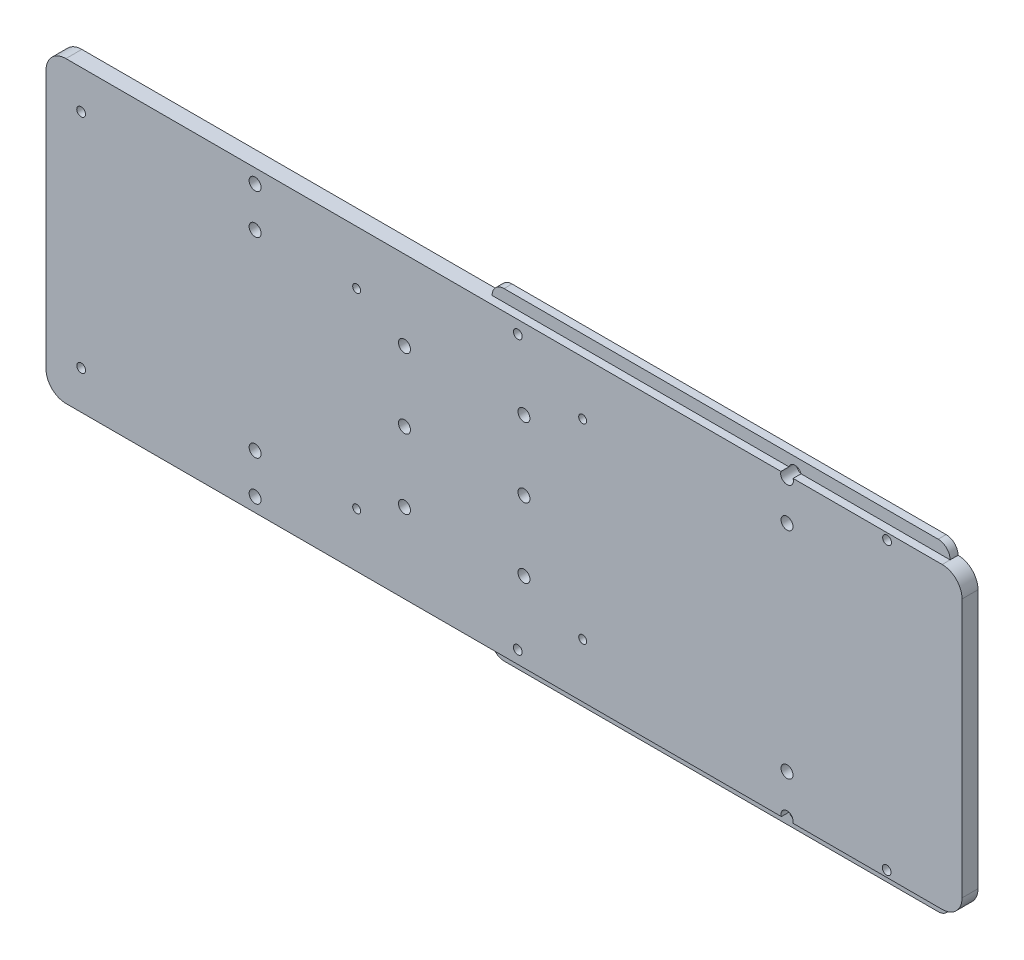
from build123d import *

# Parameters (mm, degrees)
SKETCH1_W             = 230
SKETCH1_H             = 75
BOSS_EXTRUDE1_DEPTH   = 4
CUT_EXTRUDE1_DEPTH    = 1
FILLET1_R             = 5
SKETCH4_W             = 115
SKETCH4_H             = 3
BOSS_EXTRUDE2_DEPTH   = 2
BOSS_EXTRUDE2_2_DEPTH = 2
FILLET4_R             = 3
FILLET5_R             = 3
FILLET6_R             = 3
SKETCH5_R             = 1.1
CUT_EXTRUDE2_DEPTH    = 243.899156125
SKETCH6_R             = 1.5
CUT_EXTRUDE3_DEPTH    = 243.899156125
SKETCH7_R             = 1.5
CUT_EXTRUDE4_DEPTH    = 243.899156125
SKETCH8_R             = 1
CUT_EXTRUDE5_DEPTH    = 243.899156125
SKETCH6_3_R           = 1.5
CUT_EXTRUDE6_DEPTH    = 10
SKETCH9_R             = 1.5
SKETCH9_R_2           = 1.6
CUT_EXTRUDE7_DEPTH    = 10


with BuildPart() as part:
    # Sketch1 → Boss-Extrude1 (new body)
    with BuildSketch(Plane.XY):
        with Locations((115, 37.5)):
            Rectangle(SKETCH1_W, SKETCH1_H)
    extrude(amount=BOSS_EXTRUDE1_DEPTH)

    # Sketch2 → Cut-Extrude1 (cut)
    # profile 1 of 6: a face of its own
    with BuildSketch(Plane(origin=(0, 0, 0), x_dir=(-1, 0, 0), z_dir=(0, 0, -1))):
        with BuildLine():
            Line((-12.568483623, 29.103311562), (-12.568483623, 29.786204191))
            add(Edge.make_bspline(
                [(-12.568483623, 29.786204191), (-12.56831064, 29.819633196), (-12.567975355, 29.884426928), (-12.562654622, 29.978639205), (-12.55558121, 30.066912835), (-12.543715943, 30.149091828), (-12.531413227, 30.225710909), (-12.513355784, 30.295992234), (-12.49341068, 30.360524497), (-12.462722431, 30.438014536), (-12.415063194, 30.525937603), (-12.344380016, 30.620438448), (-12.259636594, 30.702584349), (-12.16306478, 30.772432715), (-12.056824841, 30.828487514), (-11.943202564, 30.868527648), (-11.824109507, 30.894250956), (-11.742460206, 30.896863181), (-11.701195963, 30.898183357)],
                knots=[0, 0, 0, 0, 1.00128172, 1.940733171, 2.826250472, 3.653024905, 4.427672124, 5.149348099, 5.824709082, 6.450061444, 7.643590664, 8.808605388, 9.972104426, 11.165284501, 12.367876273, 13.557044126, 14.765369432, 16, 16, 16, 16], degree=3))
            add(Edge.make_bspline(
                [(-11.701195963, 30.898183357), (-11.662545107, 30.897083747), (-11.58659253, 30.894922908), (-11.475694689, 30.874511937), (-11.370237326, 30.84211681), (-11.270310695, 30.797345438), (-11.177774939, 30.73966003), (-11.09291671, 30.670544802), (-11.018943182, 30.587503409), (-10.977603369, 30.5252553), (-10.956604617, 30.493636082)],
                knots=[0, 0, 0, 0, 1.044641374, 2.052818814, 3.038628718, 4.023282556, 5.005660861, 5.98021751, 6.974042014, 8, 8, 8, 8], degree=3))
            add(Edge.make_bspline(
                [(-10.956604617, 30.493636082), (-10.941334675, 30.53339267), (-10.912119494, 30.609456872), (-10.860548157, 30.714192694), (-10.804253114, 30.804100181), (-10.743725887, 30.88093563), (-10.677521759, 30.946302707), (-10.605102849, 31.002914377), (-10.526528446, 31.051856268), (-10.442087333, 31.093505478), (-10.352495359, 31.126221453), (-10.258846799, 31.150267241), (-10.161500655, 31.164490847), (-10.095439613, 31.166431165), (-10.061973207, 31.167414127)],
                knots=[0, 0, 0, 0, 1.272586185, 2.434772614, 3.483318042, 4.437947805, 5.351807173, 6.25737843, 7.180033415, 8.1141739, 9.066731021, 10.025721652, 10.999834114, 12, 12, 12, 12], degree=3))
            add(Edge.make_bspline(
                [(-10.061973207, 31.167414127), (-10.027806196, 31.166437494), (-9.960581644, 31.164515942), (-9.861828495, 31.150332921), (-9.76744625, 31.126335022), (-9.676867921, 31.093222638), (-9.590283418, 31.050303477), (-9.508006409, 30.99731737), (-9.429865717, 30.935008136), (-9.355723433, 30.86458863), (-9.287880913, 30.786111599), (-9.229559225, 30.69962486), (-9.179410885, 30.607497729), (-9.138581895, 30.508552447), (-9.107082356, 30.403041601), (-9.085135841, 30.291023904), (-9.0703235, 30.172683832), (-9.069107322, 30.091473486), (-9.068483623, 30.049825986)],
                knots=[0, 0, 0, 0, 0.978680899, 1.925582087, 2.851223405, 3.764209995, 4.683484765, 5.614004905, 6.562443559, 7.542772147, 8.539900013, 9.527881485, 10.525548727, 11.540192123, 12.58875426, 13.674701727, 14.807505862, 16, 16, 16, 16], degree=3))
            Line((-9.068483623, 30.049825986), (-9.068483623, 29.103311562))
            Line((-9.068483623, 29.103311562), (-12.568483623, 29.103311562))
        make_face()
        with BuildLine():
            Line((-12.209509265, 29.417414127), (-11.087714393, 29.417414127))
            Line((-11.087714393, 29.417414127), (-11.087714393, 29.628451787))
            add(Edge.make_bspline(
                [(-11.087714393, 29.628451787), (-11.088114316, 29.659300582), (-11.088887048, 29.718906742), (-11.091100566, 29.805226637), (-11.097298607, 29.885351659), (-11.103494878, 29.959143481), (-11.113569437, 30.026485959), (-11.125561653, 30.087229711), (-11.138244256, 30.142328661), (-11.159815021, 30.205866718), (-11.191684022, 30.27794976), (-11.241190126, 30.354742992), (-11.300108641, 30.422756808), (-11.36872836, 30.47950191), (-11.443467299, 30.526353464), (-11.523669321, 30.559174451), (-11.607720465, 30.581055226), (-11.665533102, 30.58306194), (-11.694885867, 30.584080793)],
                knots=[0, 0, 0, 0, 1.156917035, 2.235399477, 3.236897345, 4.169954739, 5.01148057, 5.788325709, 6.491867502, 7.129259015, 8.302032419, 9.437271567, 10.542795419, 11.662606952, 12.764338259, 13.836858145, 14.901724648, 16, 16, 16, 16], degree=3))
            add(Edge.make_bspline(
                [(-11.694885867, 30.584080793), (-11.714314185, 30.583563482), (-11.752424953, 30.58254872), (-11.808162146, 30.573935897), (-11.860534663, 30.559980837), (-11.910045149, 30.541081924), (-11.955463151, 30.515263204), (-11.998958856, 30.485335915), (-12.037927086, 30.448386428), (-12.074243921, 30.406630228), (-12.106747368, 30.358853687), (-12.133671436, 30.304027459), (-12.158073587, 30.243568886), (-12.176137774, 30.175837693), (-12.192022395, 30.102237295), (-12.202002808, 30.021771113), (-12.208425299, 29.934949046), (-12.209139883, 29.874792259), (-12.209509265, 29.843696178)],
                knots=[0, 0, 0, 0, 0.911708768, 1.788416306, 2.640049961, 3.452993646, 4.268229297, 5.087074648, 5.92553149, 6.781184137, 7.681934069, 8.628939405, 9.643570426, 10.73771997, 11.914765019, 13.176320755, 14.540391495, 16, 16, 16, 16], degree=3))
            Line((-12.209509265, 29.843696178), (-12.209509265, 29.417414127))
        make_face(mode=Mode.SUBTRACT)
        with BuildLine():
            Line((-10.728740034, 29.417414127), (-9.427457982, 29.417414127))
            Line((-9.427457982, 29.417414127), (-9.427457982, 29.864729832))
            add(Edge.make_bspline(
                [(-9.427457982, 29.864729832), (-9.427879887, 29.896745409), (-9.428693053, 29.958451213), (-9.430600096, 30.047613953), (-9.43781415, 30.130038379), (-9.444469083, 30.205984509), (-9.455848732, 30.275250782), (-9.466588161, 30.338369998), (-9.482530077, 30.394306012), (-9.504440366, 30.459764089), (-9.539516017, 30.532931089), (-9.590761212, 30.612889451), (-9.654005695, 30.682611903), (-9.725934316, 30.74246212), (-9.803926891, 30.791853118), (-9.886963816, 30.827295831), (-9.973430181, 30.849321197), (-10.032399449, 30.851978763), (-10.061973207, 30.853311562)],
                knots=[0, 0, 0, 0, 1.160376723, 2.23647316, 3.230273494, 4.158083346, 4.997711197, 5.773399541, 6.476071462, 7.102777513, 8.27340052, 9.405620712, 10.53304798, 11.669441455, 12.787990954, 13.865552736, 14.929550474, 16, 16, 16, 16], degree=3))
            add(Edge.make_bspline(
                [(-10.061973207, 30.853311562), (-10.080466946, 30.853036304), (-10.117156118, 30.852490226), (-10.17106613, 30.844217284), (-10.223313457, 30.832248958), (-10.274115822, 30.816486329), (-10.32261905, 30.794451023), (-10.369009151, 30.767437585), (-10.414220639, 30.736515905), (-10.472117865, 30.688809603), (-10.537996878, 30.61840727), (-10.601699781, 30.518357699), (-10.653903694, 30.405225908), (-10.675973273, 30.322980769), (-10.687373848, 30.280495056)],
                knots=[0, 0, 0, 0, 0.723302347, 1.434937762, 2.129609326, 2.821140842, 3.513216847, 4.209993937, 4.920569932, 5.655069131, 7.14393391, 8.6716197, 10.280644748, 12, 12, 12, 12], degree=3))
            add(Edge.make_bspline(
                [(-10.687373848, 30.280495056), (-10.690828932, 30.26346596), (-10.698320266, 30.226543368), (-10.70622797, 30.166335787), (-10.71327303, 30.097599919), (-10.718484187, 30.020177041), (-10.723870731, 29.9339692), (-10.725965552, 29.838792281), (-10.728464812, 29.735034967), (-10.728645946, 29.663042594), (-10.728740034, 29.6256473)],
                knots=[0, 0, 0, 0, 0.634451884, 1.375622551, 2.216452059, 3.157844607, 4.20941857, 5.370758133, 6.634282058, 8, 8, 8, 8], degree=3))
            Line((-10.728740034, 29.6256473), (-10.728740034, 29.417414127))
        make_face(mode=Mode.SUBTRACT)
    # profile 2 of 6: a face of its own
    with BuildSketch(Plane(origin=(0, 0, 0), x_dir=(-1, 0, 0), z_dir=(0, 0, -1))):
        with BuildLine():
            add(Edge.make_bspline(
                [(-12.658227213, 33.523183357), (-12.656613367, 33.587998529), (-12.653443641, 33.715300875), (-12.628378854, 33.902222397), (-12.587124838, 34.081208135), (-12.528865359, 34.252360988), (-12.453339265, 34.415030017), (-12.361596689, 34.569674643), (-12.253080096, 34.715831412), (-12.129382946, 34.852494268), (-11.99391438, 34.977162453), (-11.848892711, 35.086559433), (-11.696141244, 35.178846109), (-11.535652011, 35.254392805), (-11.367799711, 35.313701968), (-11.191643617, 35.354618134), (-11.008337498, 35.380757071), (-10.883310555, 35.38381274), (-10.819885867, 35.385362845)],
                knots=[0, 0, 0, 0, 1.065064174, 2.09187391, 3.093564831, 4.079973196, 5.057907931, 6.036227367, 7.030399151, 8.044883615, 9.061699972, 10.052012555, 11.025713132, 11.989727027, 12.962874294, 13.945865945, 14.957962116, 16, 16, 16, 16], degree=3))
            add(Edge.make_bspline(
                [(-10.819885867, 35.385362845), (-10.756928747, 35.383812218), (-10.63283297, 35.380755754), (-10.450684847, 35.354596925), (-10.275611329, 35.313519398), (-10.108002633, 35.255127133), (-9.94783936, 35.179522466), (-9.794972255, 35.08709993), (-9.649563232, 34.977910573), (-9.513161398, 34.853771793), (-9.388385301, 34.718045157), (-9.278327923, 34.573580848), (-9.186001073, 34.420833454), (-9.109610967, 34.261385889), (-9.051537798, 34.09398612), (-9.009258613, 33.919852319), (-8.983379163, 33.738035746), (-8.980303379, 33.614180697), (-8.978740034, 33.551228229)],
                knots=[0, 0, 0, 0, 1.043748596, 2.057349401, 3.045489418, 4.02252776, 4.995289225, 5.97782527, 6.980224157, 8.006516136, 9.032559198, 10.034193337, 11.013412982, 11.987833483, 12.961212594, 13.946489799, 14.956251404, 16, 16, 16, 16], degree=3))
            add(Edge.make_bspline(
                [(-8.978740034, 33.551228229), (-8.980289421, 33.48780391), (-8.983343675, 33.362777694), (-9.009525079, 33.179240659), (-9.050466383, 33.002962915), (-9.108975819, 32.834448564), (-9.18459305, 32.673603634), (-9.276797429, 32.520113551), (-9.38620457, 32.374594404), (-9.510371145, 32.238252658), (-9.645542697, 32.11350346), (-9.790376952, 32.004744084), (-9.942032409, 31.912518971), (-10.100929933, 31.837155638), (-10.266301375, 31.777491179), (-10.439249853, 31.736786361), (-10.618789359, 31.710450408), (-10.741032257, 31.707415562), (-10.803058944, 31.705875665)],
                knots=[0, 0, 0, 0, 1.053102029, 2.075944431, 3.073151272, 4.055350789, 5.033113405, 6.020478099, 7.024410459, 8.052272461, 9.079885166, 10.07527673, 11.055994387, 12.023226415, 12.992069828, 13.970394897, 14.97016774, 16, 16, 16, 16], degree=3))
            add(Edge.make_bspline(
                [(-10.803058944, 31.705875665), (-10.844691613, 31.706410301), (-10.927431737, 31.707472827), (-11.050298337, 31.720264519), (-11.171188995, 31.738826221), (-11.289759943, 31.765428133), (-11.405720927, 31.8002198), (-11.51987169, 31.841271827), (-11.631055414, 31.891411673), (-11.739798806, 31.948092321), (-11.844406711, 32.011354129), (-11.943286295, 32.081229878), (-12.037267291, 32.155265247), (-12.123914295, 32.23642864), (-12.205747952, 32.322045086), (-12.281510669, 32.413503464), (-12.35188562, 32.510245708), (-12.415305961, 32.612688088), (-12.472665095, 32.718306363), (-12.521886946, 32.827183141), (-12.564133008, 32.937839712), (-12.598373833, 33.05079436), (-12.625405869, 33.165747132), (-12.643813223, 33.282948917), (-12.65663754, 33.402306343), (-12.657695042, 33.482717662), (-12.658227213, 33.523183357)],
                knots=[0, 0, 0, 0, 1.037015668, 2.060948919, 3.074880161, 4.083647147, 5.086022904, 6.090072063, 7.104153813, 8.122640571, 9.144368836, 10.147691507, 11.138137339, 12.123020368, 13.103399296, 14.087645067, 15.080126199, 16.082011238, 17.087798457, 18.072939717, 19.057185487, 20.037253025, 21.01195951, 21.997135196, 22.992090687, 24, 24, 24, 24], degree=3))
        make_face()
        with BuildLine():
            add(Edge.make_bspline(
                [(-12.299252854, 33.538608037), (-12.298849376, 33.505392979), (-12.298046277, 33.4392804), (-12.287409683, 33.341002144), (-12.272358407, 33.243986564), (-12.250498675, 33.148421399), (-12.222224062, 33.05410623), (-12.188122647, 32.960999186), (-12.146905977, 32.869419499), (-12.100552823, 32.779481579), (-12.047903055, 32.693262697), (-11.991994144, 32.610555213), (-11.930748771, 32.533510419), (-11.86549146, 32.461069934), (-11.795655879, 32.393413912), (-11.721700646, 32.330572194), (-11.643305886, 32.272596314), (-11.560794225, 32.220183985), (-11.474626344, 32.173541104), (-11.386449402, 32.131779777), (-11.295227136, 32.09716123), (-11.201528801, 32.069738184), (-11.105767305, 32.0464623), (-11.007420904, 32.031861944), (-10.906828633, 32.021120547), (-10.838846391, 32.020361933), (-10.804461188, 32.019978229)],
                knots=[0, 0, 0, 0, 1.008406545, 2.007172654, 2.999155034, 3.989332444, 4.982025741, 5.988181096, 6.998684226, 8.030553839, 9.059268815, 10.065399129, 11.060956322, 12.046057109, 13.024974577, 14.012068307, 14.991706172, 15.984221787, 16.978487447, 17.966117052, 18.945677757, 19.938371053, 20.93015022, 21.936155317, 22.956113857, 24, 24, 24, 24], degree=3))
            add(Edge.make_bspline(
                [(-10.804461188, 32.019978229), (-10.753900116, 32.021256008), (-10.654430848, 32.023769794), (-10.508646302, 32.045685748), (-10.368404778, 32.079712431), (-10.234542169, 32.129044694), (-10.106461545, 32.191977731), (-9.98466135, 32.268743259), (-9.869177513, 32.360044289), (-9.760869697, 32.463693242), (-9.662052217, 32.57703064), (-9.575191133, 32.697320594), (-9.502086422, 32.823611415), (-9.440972527, 32.955175196), (-9.394931861, 33.093135205), (-9.362104887, 33.236606896), (-9.340828793, 33.385593439), (-9.338762378, 33.487119134), (-9.337714393, 33.538608037)],
                knots=[0, 0, 0, 0, 1.032022337, 2.030307203, 3.003823408, 3.974715386, 4.937372378, 5.913284036, 6.909147208, 7.938749767, 8.970518239, 9.975863271, 10.963918693, 11.946286286, 12.933361397, 13.927862637, 14.949112547, 16, 16, 16, 16], degree=3))
            add(Edge.make_bspline(
                [(-9.337714393, 33.538608037), (-9.338189513, 33.573217675), (-9.339131821, 33.641858981), (-9.348636119, 33.743952508), (-9.36384689, 33.84421621), (-9.385855445, 33.942464834), (-9.41303579, 34.038827108), (-9.446750208, 34.133012272), (-9.487165713, 34.224989043), (-9.532207456, 34.315209692), (-9.583373663, 34.401654091), (-9.63852887, 34.48385989), (-9.698693591, 34.560771948), (-9.763074469, 34.633178445), (-9.832695376, 34.700360313), (-9.906201155, 34.763023107), (-9.9847623, 34.819996568), (-10.066936013, 34.872231218), (-10.152475678, 34.919443214), (-10.240895037, 34.959996582), (-10.331719868, 34.994629999), (-10.425016902, 35.022548456), (-10.520576276, 35.044436631), (-10.618534754, 35.059515814), (-10.718693988, 35.070064452), (-10.786437859, 35.070859502), (-10.820586989, 35.07126028)],
                knots=[0, 0, 0, 0, 1.047334373, 2.07717862, 3.100662057, 4.115010574, 5.122652213, 6.129548646, 7.140165612, 8.16200981, 9.179904151, 10.178566626, 11.156366481, 12.133321541, 13.108841334, 14.082538371, 15.054589433, 16.043660176, 17.028268541, 18.009491307, 18.985652105, 19.968123554, 20.954864208, 21.950389976, 22.966808393, 24, 24, 24, 24], degree=3))
            add(Edge.make_bspline(
                [(-10.820586989, 35.07126028), (-10.854502493, 35.070859167), (-10.921780143, 35.070063486), (-11.021240962, 35.059521011), (-11.118494173, 35.044420121), (-11.213157976, 35.022657413), (-11.305256502, 34.99460726), (-11.394703245, 34.960019926), (-11.481831461, 34.919234641), (-11.566425679, 34.872426362), (-11.64760071, 34.819810739), (-11.725202033, 34.762315753), (-11.797778842, 34.698953177), (-11.867098324, 34.631516783), (-11.931773947, 34.558385253), (-11.991555815, 34.479545824), (-12.049137499, 34.396961495), (-12.100097928, 34.308764682), (-12.147395423, 34.218068914), (-12.187747446, 34.124919272), (-12.222404119, 34.03064607), (-12.250583081, 33.934872386), (-12.272274673, 33.837643489), (-12.287423153, 33.739015924), (-12.298042624, 33.639333955), (-12.298848164, 33.572289889), (-12.299252854, 33.538608037)],
                knots=[0, 0, 0, 0, 1.029877221, 2.042951179, 3.035109885, 4.018542222, 4.991021277, 5.957494829, 6.929429462, 7.911425532, 8.892163142, 9.866273635, 10.842761649, 11.81676864, 12.802607151, 13.805177466, 14.821356543, 15.858816981, 16.897175917, 17.927346774, 18.940346092, 19.946830556, 20.957962087, 21.964146003, 22.97721996, 24, 24, 24, 24], degree=3))
        make_face(mode=Mode.SUBTRACT)
    # profile 3 of 6: a face of its own
    with BuildSketch(Plane(origin=(0, 0, 0), x_dir=(-1, 0, 0), z_dir=(0, 0, -1))):
        Polygon((-12.209509265, 35.699465409), (-12.568483623, 35.699465409), (-12.568483623, 37.539208998), (-12.209509265, 37.539208998), (-12.209509265, 36.776388486), (-9.068483623, 36.776388486), (-9.068483623, 36.462285921), (-12.209509265, 36.462285921), align=None)
    # profile 4 of 6: a face of its own
    with BuildSketch(Plane(origin=(0, 0, 0), x_dir=(-1, 0, 0), z_dir=(0, 0, -1))):
        Polygon((-12.209509265, 37.763567973), (-12.568483623, 37.763567973), (-12.568483623, 39.603311562), (-12.209509265, 39.603311562), (-12.209509265, 38.84049105), (-9.068483623, 38.84049105), (-9.068483623, 38.526388486), (-12.209509265, 38.526388486), align=None)
    # profile 5 of 6: a face of its own
    with BuildSketch(Plane(origin=(0, 0, 0), x_dir=(-1, 0, 0), z_dir=(0, 0, -1))):
        with BuildLine():
            add(Edge.make_bspline(
                [(-12.658227213, 41.869337203), (-12.656613367, 41.934152375), (-12.653443641, 42.061454721), (-12.628378854, 42.248376243), (-12.587124838, 42.427361982), (-12.528865359, 42.598514834), (-12.453339265, 42.761183863), (-12.361596689, 42.915828489), (-12.253080096, 43.061985258), (-12.129382946, 43.198648114), (-11.99391438, 43.323316299), (-11.848892711, 43.432713279), (-11.696141244, 43.524999955), (-11.535652011, 43.600546651), (-11.367799711, 43.659855814), (-11.191643617, 43.70077198), (-11.008337498, 43.726910917), (-10.883310555, 43.729966586), (-10.819885867, 43.731516691)],
                knots=[0, 0, 0, 0, 1.065064174, 2.09187391, 3.093564831, 4.079973196, 5.057907931, 6.036227367, 7.030399151, 8.044883615, 9.061699972, 10.052012555, 11.025713132, 11.989727027, 12.962874294, 13.945865945, 14.957962116, 16, 16, 16, 16], degree=3))
            add(Edge.make_bspline(
                [(-10.819885867, 43.731516691), (-10.756928747, 43.729966064), (-10.63283297, 43.7269096), (-10.450684847, 43.700750771), (-10.275611329, 43.659673244), (-10.108002633, 43.601280979), (-9.94783936, 43.525676312), (-9.794972255, 43.433253776), (-9.649563232, 43.324064419), (-9.513161398, 43.199925639), (-9.388385301, 43.064199004), (-9.278327923, 42.919734694), (-9.186001073, 42.7669873), (-9.109610967, 42.607539735), (-9.051537798, 42.440139966), (-9.009258613, 42.266006165), (-8.983379163, 42.084189592), (-8.980303379, 41.960334543), (-8.978740034, 41.897382075)],
                knots=[0, 0, 0, 0, 1.043748596, 2.057349401, 3.045489418, 4.02252776, 4.995289225, 5.97782527, 6.980224157, 8.006516136, 9.032559198, 10.034193337, 11.013412982, 11.987833483, 12.961212594, 13.946489799, 14.956251404, 16, 16, 16, 16], degree=3))
            add(Edge.make_bspline(
                [(-8.978740034, 41.897382075), (-8.980289421, 41.833957756), (-8.983343675, 41.70893154), (-9.009525079, 41.525394505), (-9.050466383, 41.349116761), (-9.108975819, 41.18060241), (-9.18459305, 41.01975748), (-9.276797429, 40.866267398), (-9.38620457, 40.72074825), (-9.510371145, 40.584406504), (-9.645542697, 40.459657306), (-9.790376952, 40.35089793), (-9.942032409, 40.258672817), (-10.100929933, 40.183309484), (-10.266301375, 40.123645025), (-10.439249853, 40.082940207), (-10.618789359, 40.056604255), (-10.741032257, 40.053569408), (-10.803058944, 40.052029511)],
                knots=[0, 0, 0, 0, 1.053102029, 2.075944431, 3.073151272, 4.055350789, 5.033113405, 6.020478099, 7.024410459, 8.052272461, 9.079885166, 10.07527673, 11.055994387, 12.023226415, 12.992069828, 13.970394897, 14.97016774, 16, 16, 16, 16], degree=3))
            add(Edge.make_bspline(
                [(-10.803058944, 40.052029511), (-10.844691613, 40.052564147), (-10.927431737, 40.053626673), (-11.050298337, 40.066418365), (-11.171188995, 40.084980067), (-11.289759943, 40.111581979), (-11.405720927, 40.146373646), (-11.51987169, 40.187425674), (-11.631055414, 40.237565519), (-11.739798806, 40.294246167), (-11.844406711, 40.357507975), (-11.943286295, 40.427383724), (-12.037267291, 40.501419093), (-12.123914295, 40.582582487), (-12.205747952, 40.668198932), (-12.281510669, 40.75965731), (-12.35188562, 40.856399554), (-12.415305961, 40.958841934), (-12.472665095, 41.064460209), (-12.521886946, 41.173336987), (-12.564133008, 41.283993558), (-12.598373833, 41.396948206), (-12.625405869, 41.511900978), (-12.643813223, 41.629102763), (-12.65663754, 41.748460189), (-12.657695042, 41.828871508), (-12.658227213, 41.869337203)],
                knots=[0, 0, 0, 0, 1.037015668, 2.060948919, 3.074880161, 4.083647147, 5.086022904, 6.090072063, 7.104153813, 8.122640571, 9.144368836, 10.147691507, 11.138137339, 12.123020368, 13.103399296, 14.087645067, 15.080126199, 16.082011238, 17.087798457, 18.072939717, 19.057185487, 20.037253025, 21.01195951, 21.997135196, 22.992090687, 24, 24, 24, 24], degree=3))
        make_face()
        with BuildLine():
            add(Edge.make_bspline(
                [(-12.299252854, 41.884761883), (-12.298849376, 41.851546825), (-12.298046277, 41.785434246), (-12.287409683, 41.68715599), (-12.272358407, 41.59014041), (-12.250498675, 41.494575245), (-12.222224062, 41.400260076), (-12.188122647, 41.307153032), (-12.146905977, 41.215573345), (-12.100552823, 41.125635425), (-12.047903055, 41.039416543), (-11.991994144, 40.956709059), (-11.930748771, 40.879664265), (-11.86549146, 40.80722378), (-11.795655879, 40.739567758), (-11.721700646, 40.67672604), (-11.643305886, 40.61875016), (-11.560794225, 40.566337831), (-11.474626344, 40.51969495), (-11.386449402, 40.477933623), (-11.295227136, 40.443315077), (-11.201528801, 40.41589203), (-11.105767305, 40.392616147), (-11.007420904, 40.37801579), (-10.906828633, 40.367274393), (-10.838846391, 40.366515779), (-10.804461188, 40.366132075)],
                knots=[0, 0, 0, 0, 1.008406545, 2.007172654, 2.999155034, 3.989332444, 4.982025741, 5.988181096, 6.998684226, 8.030553839, 9.059268815, 10.065399129, 11.060956322, 12.046057109, 13.024974577, 14.012068307, 14.991706172, 15.984221787, 16.978487447, 17.966117052, 18.945677757, 19.938371053, 20.93015022, 21.936155317, 22.956113857, 24, 24, 24, 24], degree=3))
            add(Edge.make_bspline(
                [(-10.804461188, 40.366132075), (-10.753900116, 40.367409854), (-10.654430848, 40.36992364), (-10.508646302, 40.391839594), (-10.368404778, 40.425866277), (-10.234542169, 40.475198541), (-10.106461545, 40.538131577), (-9.98466135, 40.614897105), (-9.869177513, 40.706198135), (-9.760869697, 40.809847088), (-9.662052217, 40.923184486), (-9.575191133, 41.04347444), (-9.502086422, 41.169765262), (-9.440972527, 41.301329042), (-9.394931861, 41.439289051), (-9.362104887, 41.582760742), (-9.340828793, 41.731747286), (-9.338762378, 41.83327298), (-9.337714393, 41.884761883)],
                knots=[0, 0, 0, 0, 1.032022337, 2.030307203, 3.003823408, 3.974715386, 4.937372378, 5.913284036, 6.909147208, 7.938749767, 8.970518239, 9.975863271, 10.963918693, 11.946286286, 12.933361397, 13.927862637, 14.949112547, 16, 16, 16, 16], degree=3))
            add(Edge.make_bspline(
                [(-9.337714393, 41.884761883), (-9.338189513, 41.919371521), (-9.339131821, 41.988012827), (-9.348636119, 42.090106354), (-9.36384689, 42.190370056), (-9.385855445, 42.28861868), (-9.41303579, 42.384980954), (-9.446750208, 42.479166118), (-9.487165713, 42.571142889), (-9.532207456, 42.661363538), (-9.583373663, 42.747807937), (-9.63852887, 42.830013736), (-9.698693591, 42.906925794), (-9.763074469, 42.979332291), (-9.832695376, 43.046514159), (-9.906201155, 43.109176953), (-9.9847623, 43.166150414), (-10.066936013, 43.218385064), (-10.152475678, 43.26559706), (-10.240895037, 43.306150429), (-10.331719868, 43.340783845), (-10.425016902, 43.368702302), (-10.520576276, 43.390590477), (-10.618534754, 43.40566966), (-10.718693988, 43.416218298), (-10.786437859, 43.417013348), (-10.820586989, 43.417414127)],
                knots=[0, 0, 0, 0, 1.047334373, 2.07717862, 3.100662057, 4.115010574, 5.122652213, 6.129548646, 7.140165612, 8.16200981, 9.179904151, 10.178566626, 11.156366481, 12.133321541, 13.108841334, 14.082538371, 15.054589433, 16.043660176, 17.028268541, 18.009491307, 18.985652105, 19.968123554, 20.954864208, 21.950389976, 22.966808393, 24, 24, 24, 24], degree=3))
            add(Edge.make_bspline(
                [(-10.820586989, 43.417414127), (-10.854502493, 43.417013014), (-10.921780143, 43.416217332), (-11.021240962, 43.405674857), (-11.118494173, 43.390573967), (-11.213157976, 43.368811259), (-11.305256502, 43.340761106), (-11.394703245, 43.306173772), (-11.481831461, 43.265388487), (-11.566425679, 43.218580209), (-11.64760071, 43.165964585), (-11.725202033, 43.108469599), (-11.797778842, 43.045107024), (-11.867098324, 42.977670629), (-11.931773947, 42.904539099), (-11.991555815, 42.82569967), (-12.049137499, 42.743115341), (-12.100097928, 42.654918528), (-12.147395423, 42.56422276), (-12.187747446, 42.471073118), (-12.222404119, 42.376799916), (-12.250583081, 42.281026232), (-12.272274673, 42.183797335), (-12.287423153, 42.08516977), (-12.298042624, 41.985487801), (-12.298848164, 41.918443735), (-12.299252854, 41.884761883)],
                knots=[0, 0, 0, 0, 1.029877221, 2.042951179, 3.035109885, 4.018542222, 4.991021277, 5.957494829, 6.929429462, 7.911425532, 8.892163142, 9.866273635, 10.842761649, 11.81676864, 12.802607151, 13.805177466, 14.821356543, 15.858816981, 16.897175917, 17.927346774, 18.940346092, 19.946830556, 20.957962087, 21.964146003, 22.97721996, 24, 24, 24, 24], degree=3))
        make_face(mode=Mode.SUBTRACT)
    # profile 6 of 6: a face of its own
    with BuildSketch(Plane(origin=(0, 0, 0), x_dir=(-1, 0, 0), z_dir=(0, 0, -1))):
        Polygon((-9.068483623, 44.269978229), (-12.568483623, 44.732017492), (-12.568483623, 44.776889287), (-9.696688752, 46.221901306), (-12.568483623, 47.663407716), (-12.568483623, 47.708980633), (-9.068483623, 48.173824383), (-9.068483623, 47.858319575), (-11.586913111, 47.523183357), (-9.068483623, 46.259761883), (-9.068483623, 46.188948582), (-11.592522085, 44.920619255), (-9.068483623, 44.586184159), align=None)
    extrude(amount=-CUT_EXTRUDE1_DEPTH, mode=Mode.SUBTRACT)

    # Fillet1
    fillet1_edges = [part.edges().sort_by_distance(p)[0] for p in [
        (0, 75, 2),
        (230, 75, 2),
        (230, 0, 2),
        (0, 0, 2),
    ]]
    fillet(fillet1_edges, radius=FILLET1_R)

    # Sketch5 → Cut-Extrude2 (cut, through all)
    with BuildSketch(Plane(origin=(0, 0, 0), x_dir=(-1, 0, 0), z_dir=(0, 0, -1))):
        with Locations((-8.82, 9.65)):
            Circle(SKETCH5_R)
        with Locations((-8.82, 65.35)):
            Circle(SKETCH5_R)
        with Locations((-118.46, 71.81)):
            Circle(SKETCH5_R)
        with Locations((-118.46, 3.19)):
            Circle(SKETCH5_R)
        with Locations((-211.07, 1.6)):
            Circle(SKETCH5_R)
        with Locations((-211.17, 73.4)):
            Circle(SKETCH5_R)
    extrude(amount=-CUT_EXTRUDE2_DEPTH, mode=Mode.SUBTRACT)

    # Sketch6 → Cut-Extrude3 (cut, through all)
    with BuildSketch(Plane(origin=(0, 0, 0), x_dir=(-1, 0, 0), z_dir=(0, 0, -1))):
        with Locations((-186.05, 10.5)):
            Circle(SKETCH6_R)
        with Locations((-186.05, 64.5)):
            Circle(SKETCH6_R)
        with Locations((-186.05, 0.5)):
            Circle(SKETCH6_R)
        with Locations((-186.05, 74.5)):
            Circle(SKETCH6_R)
    extrude(amount=-CUT_EXTRUDE3_DEPTH, mode=Mode.SUBTRACT)

    # Sketch7 → Cut-Extrude4 (cut, through all)
    with BuildSketch(Plane(origin=(0, 0, 0), x_dir=(-1, 0, 0), z_dir=(0, 0, -1))):
        with Locations((-120, 20)):
            Circle(SKETCH7_R)
        with Locations((-120, 55)):
            Circle(SKETCH7_R)
        with Locations((-90, 20)):
            Circle(SKETCH7_R)
        with Locations((-90, 55)):
            Circle(SKETCH7_R)
        with Locations((-90, 37.5)):
            Circle(SKETCH7_R)
        with Locations((-120, 37.5)):
            Circle(SKETCH7_R)
    extrude(amount=-CUT_EXTRUDE4_DEPTH, mode=Mode.SUBTRACT)

    # Sketch8 → Cut-Extrude5 (cut, through all)
    with BuildSketch(Plane(origin=(0, 0, 0), x_dir=(-1, 0, 0), z_dir=(0, 0, -1))):
        with Locations((-78, 61.5)):
            Circle(SKETCH8_R)
        with Locations((-78, 13.6)):
            Circle(SKETCH8_R)
        with Locations((-134.75, 13.6)):
            Circle(SKETCH8_R)
        with Locations((-134.75, 61.5)):
            Circle(SKETCH8_R)
    extrude(amount=-CUT_EXTRUDE5_DEPTH, mode=Mode.SUBTRACT)

    # Sketch6<3> → Cut-Extrude6 (cut)
    with BuildSketch(Plane(origin=(0, 0, 0), x_dir=(-1, 0, 0), z_dir=(0, 0, -1))):
        with Locations((-52.5, 3.5)):
            Circle(SKETCH6_3_R)
        with Locations((-52.5, 13.5)):
            Circle(SKETCH6_3_R)
        with Locations((-52.5, 61.5)):
            Circle(SKETCH6_3_R)
        with Locations((-52.5, 71.5)):
            Circle(SKETCH6_3_R)
        with Locations((-186.05, 74.5)):
            Circle(SKETCH6_3_R)
        with Locations((-186.05, 64.5)):
            Circle(SKETCH6_3_R)
        with Locations((-186.05, 10.5)):
            Circle(SKETCH6_3_R)
        with Locations((-186.05, 0.5)):
            Circle(SKETCH6_3_R)
    extrude(amount=-CUT_EXTRUDE6_DEPTH, mode=Mode.SUBTRACT)


with BuildPart() as body_2:
    # Sketch4 → Boss-Extrude2 (new body)
    with BuildSketch(Plane(origin=(0, 0, 0), x_dir=(-1, 0, 0), z_dir=(0, 0, -1))):
        with Locations((-167.5, 76.5)):
            Rectangle(SKETCH4_W, SKETCH4_H)
    extrude(amount=-BOSS_EXTRUDE2_DEPTH)

    # Fillet4
    fillet4_edges = [body_2.edges().sort_by_distance(p)[0] for p in [
        (225, 78, 1),
    ]]
    fillet(fillet4_edges, radius=FILLET4_R - 0.0001)  # a hair under: the kernel refuses the full size

    # Fillet6
    fillet6_edges = [body_2.edges().sort_by_distance(p)[0] for p in [
        (110, 78, 1),
    ]]
    fillet(fillet6_edges, radius=FILLET6_R - 0.0001)  # a hair under: the kernel refuses the full size


with BuildPart() as body_3:
    # Sketch4 → Boss-Extrude2 2 (new body)
    with BuildSketch(Plane(origin=(0, 0, 0), x_dir=(-1, 0, 0), z_dir=(0, 0, -1))):
        with Locations((-167.5, -1.5)):
            Rectangle(SKETCH4_W, SKETCH4_H)
    extrude(amount=-BOSS_EXTRUDE2_2_DEPTH)

    # Fillet5
    fillet5_edges = [body_3.edges().sort_by_distance(p)[0] for p in [
        (110, -3, 1),
        (225, -3, 1),
    ]]
    fillet(fillet5_edges, radius=FILLET5_R - 0.0001)  # a hair under: the kernel refuses the full size


with BuildPart() as cut_extrude7_tool:
    # Sketch9 → Cut-Extrude7 (new body)
    with BuildSketch(Plane(origin=(0, 0, 0), x_dir=(-1, 0, 0), z_dir=(0, 0, -1))):
        with Locations((-186.05, 0.5)):
            Circle(SKETCH9_R)
        with Locations((-186.05, 74.5)):
            Circle(SKETCH9_R_2)
    extrude(amount=-CUT_EXTRUDE7_DEPTH)


with BuildPart() as part_1:
    add(part.part)

    # Cut-Extrude7: cut by cut_extrude7_tool
    add(cut_extrude7_tool.part, mode=Mode.SUBTRACT)


with BuildPart() as body_2_1:
    add(body_2.part)

    # Cut-Extrude7: cut by cut_extrude7_tool
    add(cut_extrude7_tool.part, mode=Mode.SUBTRACT)


with BuildPart() as body_3_1:
    add(body_3.part)

    # Cut-Extrude7: cut by cut_extrude7_tool
    add(cut_extrude7_tool.part, mode=Mode.SUBTRACT)


solid = Compound([part_1.part, body_2_1.part, body_3_1.part])
